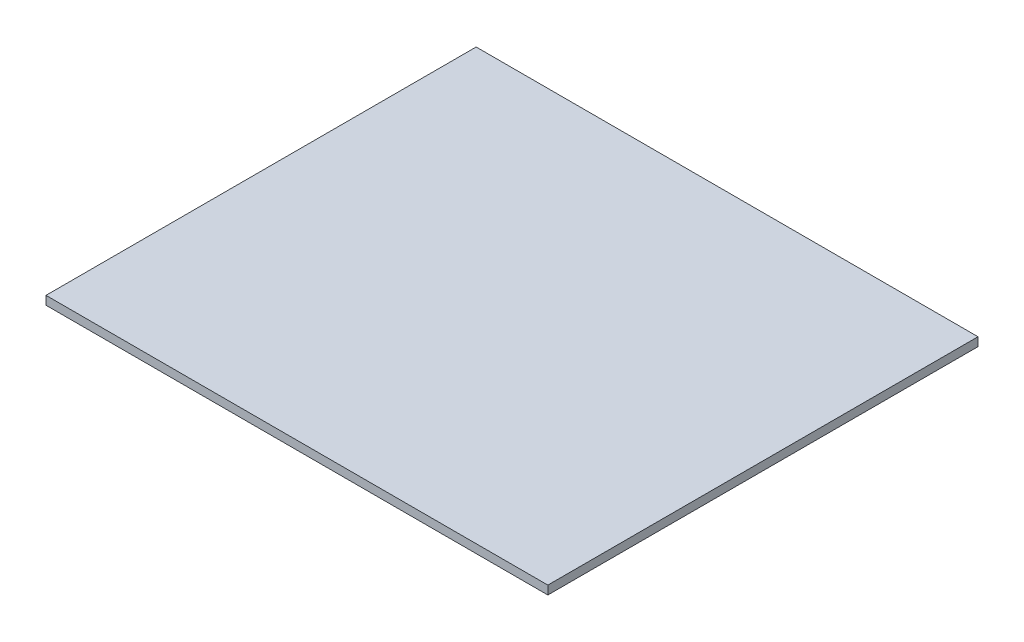
from build123d import *

# Parameters (mm, degrees)
SKETCH1_W           = 350
SKETCH1_H           = 300
BOSS_EXTRUDE1_DEPTH = 6


with BuildPart() as part:
    # Sketch1 → Boss-Extrude1 (new body)
    with BuildSketch(Plane(origin=(0, 0, 0), x_dir=(1, 0, 0), z_dir=(0, 1, 0))):
        Rectangle(SKETCH1_W, SKETCH1_H)
    extrude(amount=BOSS_EXTRUDE1_DEPTH)


solid = part.part
